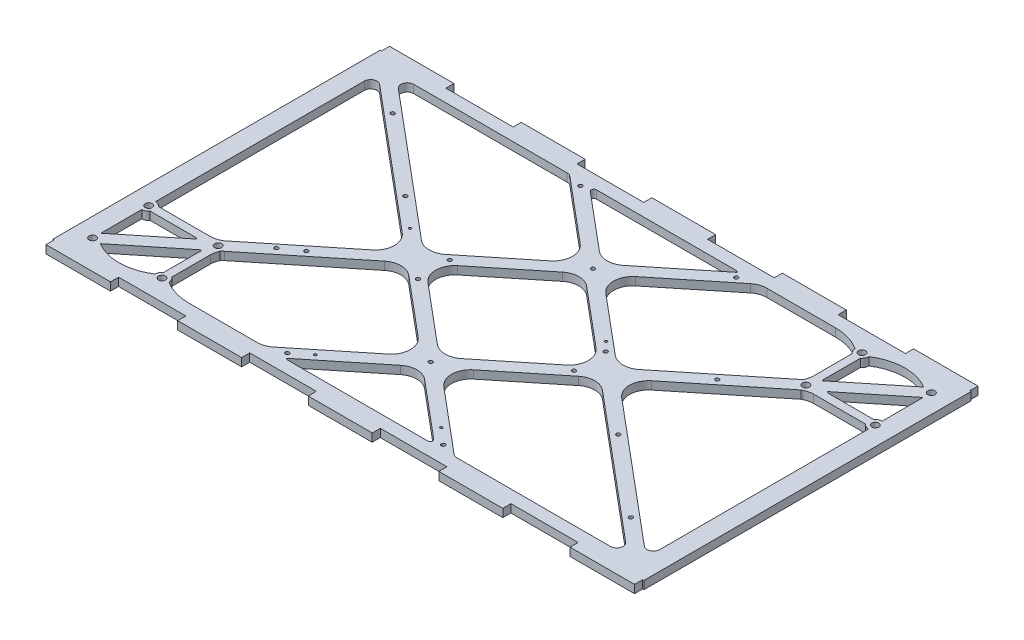
from build123d import *

# Parameters (mm, degrees)
SKETCH1_W           = 464.02
SKETCH1_H           = 269.7
BOSS_EXTRUDE1_DEPTH = 6.35
SKETCH2_R           = 2.75
CUT_EXTRUDE1_DEPTH  = 6.35
CUT_EXTRUDE2_DEPTH  = 6.35
SKETCH5_W           = 1
SKETCH5_H           = 6.36
SKETCH5_W_2         = 52.8
SKETCH5_W_3         = 52.31
CUT_EXTRUDE3_DEPTH  = 10
SKETCH7_R           = 2.75
BOSS_EXTRUDE2_DEPTH = 6.35
FILLET3_DEPTH       = 6.35
SKETCH8_R           = 1.5
CUT_EXTRUDE4_DEPTH  = 10
SKETCH9_R           = 1
SKETCH9_R_2         = 1.5
CUT_EXTRUDE5_DEPTH  = 269.427802398


with BuildPart() as part:
    # Sketch1 → Boss-Extrude1 (new body)
    with BuildSketch(Plane(origin=(0, 0, 0), x_dir=(1, 0, 0), z_dir=(0, 1, 0))):
        Rectangle(SKETCH1_W, SKETCH1_H)
    extrude(amount=BOSS_EXTRUDE1_DEPTH)

    # Sketch2 → Cut-Extrude1 (cut)
    with BuildSketch(Plane.XZ):
        with Locations(Location((-217.25, 112, 0), (0, 0, 270))):
            Circle(SKETCH2_R)
        with Locations(Location((-162.75, 112, 0), (0, 0, 270))):
            Circle(SKETCH2_R)
        with Locations(Location((-162.75, 68, 0), (0, 0, 270))):
            Circle(SKETCH2_R)
        with Locations(Location((-217.25, 68, 0), (0, 0, 270))):
            Circle(SKETCH2_R)
        with Locations(Location((217.25, -112, 0), (0, 0, 270))):
            Circle(SKETCH2_R)
        with Locations(Location((162.75, -112, 0), (0, 0, 270))):
            Circle(SKETCH2_R)
        with Locations(Location((162.75, -68, 0), (0, 0, 270))):
            Circle(SKETCH2_R)
        with Locations(Location((217.25, -68, 0), (0, 0, 270))):
            Circle(SKETCH2_R)
    extrude(amount=-CUT_EXTRUDE1_DEPTH, mode=Mode.SUBTRACT)

    # Sketch3 → Cut-Extrude2 (cut)
    with BuildSketch(Plane.XZ):
        with BuildLine():
            Line((-97.587389001, -11.684607619), (-209.038267705, -105.093705424))
            ThreePointArc((-209.038267705, -105.093705424), (-214.36439572, -105.792563893), (-217.25, -101.261633443))
            Line((-217.25, -101.261633443), (-217.25, 62.575))
            ThreePointArc((-217.25, 62.575), (-214.779549636, 63.17014493), (-212.85113651, 64.825))
            Line((-212.85113651, 64.825), (-167.14886349, 64.825))
            ThreePointArc((-167.14886349, 64.825), (-164.557122119, 62.884832882), (-161.321795409, 62.766372516))
            Line((-161.321795409, 62.766372516), (-97.80002183, 11.482738801))
            ThreePointArc((-97.80002183, 11.482738801), (-92.223217631, -0.050725582), (-97.587389001, -11.684607619))
        make_face()
        with BuildLine():
            ThreePointArc((-165.925, 78.829008315), (-167.062643852, 77.024474615), (-169.181341874, 77.272857585))
            Line((-169.181341874, 77.272857585), (-211.744216533, 111.635545383))
            ThreePointArc((-211.744216533, 111.635545383), (-211.82787845, 111.822366659), (-211.726153813, 112))
            ThreePointArc((-211.726153813, 112), (-189.950576907, 118.5), (-168.175, 112))
            ThreePointArc((-168.175, 112), (-167.57985507, 109.529549636), (-165.925, 107.60113651))
            Line((-165.925, 107.60113651), (-165.925, 78.829008315))
        make_face()
        with BuildLine():
            ThreePointArc((-69.195399046, 12.111258303), (-78.692929836, 8.60810599), (-88.253159987, 11.936343767))
            Line((-88.253159987, 11.936343767), (-157.332909959, 67.707151084))
            ThreePointArc((-157.332909959, 67.707151084), (-157.855202339, 70.339141051), (-159.575, 72.39886349))
            Line((-159.575, 72.39886349), (-159.575, 107.60113651))
            ThreePointArc((-159.575, 107.60113651), (-157.92014493, 109.529549636), (-157.325, 112))
            ThreePointArc((-157.325, 112), (-146.911924464, 116.840330407), (-135.549423093, 118.5))
            Line((-135.549423093, 118.5), (-75.076473615, 118.5))
            ThreePointArc((-75.076473615, 118.5), (-73.410923275, 118.21443974), (-71.93561893, 117.390376826))
            Line((-71.93561893, 117.390376826), (-20.746121324, 76.063076007))
            ThreePointArc((-20.746121324, 76.063076007), (-15.169317125, 64.529611624), (-20.533488495, 52.895729587))
            Line((-20.533488495, 52.895729587), (-69.195399046, 12.111258303))
        make_face()
        with BuildLine():
            ThreePointArc((-85.139517992, -14.299582162), (-75.641987202, -10.796429849), (-66.081757051, -14.124667626))
            Line((-66.081757051, -14.124667626), (-20.519005299, -50.909274546))
            ThreePointArc((-20.519005299, -50.909274546), (-14.942201099, -62.442738929), (-20.306372469, -74.076620966))
            Line((-20.306372469, -74.076620966), (-71.916527557, -117.332071981))
            ThreePointArc((-71.916527557, -117.332071981), (-73.419511758, -118.198955198), (-75.128259852, -118.5))
            Line((-75.128259852, -118.5), (-195.716337306, -118.5))
            ThreePointArc((-195.716337306, -118.5), (-200.415292504, -115.208748094), (-198.928069601, -109.667928019))
            Line((-198.928069601, -109.667928019), (-85.139517992, -14.299582162))
        make_face()
        with BuildLine():
            ThreePointArc((-56.534895208, -13.67106266), (-62.111699407, -2.137598277), (-56.747528037, 9.49628376))
            Line((-56.747528037, 9.49628376), (-8.085617485, 50.280755044))
            ThreePointArc((-8.085617485, 50.280755044), (1.411913304, 53.783907357), (10.972143455, 50.45566958))
            Line((10.972143455, 50.45566958), (56.534895208, 13.67106266))
            ThreePointArc((56.534895208, 13.67106266), (62.111699407, 2.137598277), (56.747528037, -9.49628376))
            Line((56.747528037, -9.49628376), (8.085617485, -50.280755044))
            ThreePointArc((8.085617485, -50.280755044), (-1.411913304, -53.783907357), (-10.972143455, -50.45566958))
            Line((-10.972143455, -50.45566958), (-56.534895208, -13.67106266))
        make_face()
        with BuildLine():
            ThreePointArc((-52.242235331, -118.5), (-54.12181741, -117.183499238), (-53.526928249, -114.967171208))
            Line((-53.526928249, -114.967171208), (-7.85850146, -76.691595509))
            ThreePointArc((-7.85850146, -76.691595509), (1.63902933, -73.188443196), (11.199259481, -76.516680973))
            Line((11.199259481, -76.516680973), (58.796547484, -114.94384927))
            ThreePointArc((58.796547484, -114.94384927), (59.425981506, -117.166220136), (57.54020561, -118.5))
            Line((57.54020561, -118.5), (-52.242235331, -118.5))
        make_face()
        with BuildLine():
            Line((20.533488495, -52.895729587), (69.195399046, -12.111258303))
            ThreePointArc((69.195399046, -12.111258303), (78.692929836, -8.60810599), (88.253159987, -11.936343767))
            Line((88.253159987, -11.936343767), (157.332909959, -67.707151084))
            ThreePointArc((157.332909959, -67.707151084), (157.855202339, -70.339141051), (159.575, -72.39886349))
            Line((159.575, -72.39886349), (159.575, -107.60113651))
            ThreePointArc((159.575, -107.60113651), (157.92014493, -109.529549636), (157.325, -112))
            ThreePointArc((157.325, -112), (146.911924464, -116.840330407), (135.549423093, -118.5))
            Line((135.549423093, -118.5), (73.310038543, -118.5))
            Line((73.310038543, -118.5), (20.746121324, -76.063076007))
            ThreePointArc((20.746121324, -76.063076007), (15.169317125, -64.529611624), (20.533488495, -52.895729587))
        make_face()
        with BuildLine():
            ThreePointArc((85.139517992, 14.299582162), (75.641987202, 10.796429849), (66.081757051, 14.124667626))
            Line((66.081757051, 14.124667626), (20.519005299, 50.909274546))
            ThreePointArc((20.519005299, 50.909274546), (14.942201099, 62.442738929), (20.306372469, 74.076620966))
            Line((20.306372469, 74.076620966), (71.916527557, 117.332071981))
            ThreePointArc((71.916527557, 117.332071981), (73.419511758, 118.198955198), (75.128259852, 118.5))
            Line((75.128259852, 118.5), (195.716337306, 118.5))
            ThreePointArc((195.716337306, 118.5), (200.415292504, 115.208748094), (198.928069601, 109.667928019))
            Line((198.928069601, 109.667928019), (85.139517992, 14.299582162))
        make_face()
        with BuildLine():
            Line((52.242235331, 118.5), (-57.54020561, 118.5))
            ThreePointArc((-57.54020561, 118.5), (-59.425981506, 117.166220136), (-58.796547484, 114.94384927))
            Line((-58.796547484, 114.94384927), (-11.199259481, 76.516680973))
            ThreePointArc((-11.199259481, 76.516680973), (-1.63902933, 73.188443196), (7.85850146, 76.691595509))
            Line((7.85850146, 76.691595509), (53.526928249, 114.967171208))
            ThreePointArc((53.526928249, 114.967171208), (54.12181741, 117.183499238), (52.242235331, 118.5))
        make_face()
        with BuildLine():
            ThreePointArc((97.80002183, -11.482738801), (92.223217631, 0.050725582), (97.587389001, 11.684607619))
            Line((97.587389001, 11.684607619), (209.038267705, 105.093705424))
            ThreePointArc((209.038267705, 105.093705424), (214.36439572, 105.792563893), (217.25, 101.261633443))
            Line((217.25, 101.261633443), (217.25, -62.575))
            ThreePointArc((217.25, -62.575), (214.779549636, -63.17014493), (212.85113651, -64.825))
            Line((212.85113651, -64.825), (167.14886349, -64.825))
            ThreePointArc((167.14886349, -64.825), (164.557122119, -62.884832882), (161.321795409, -62.766372516))
            Line((161.321795409, -62.766372516), (97.80002183, -11.482738801))
        make_face()
        with BuildLine():
            Line((212.85113651, -71.175), (177.398146663, -71.175))
            ThreePointArc((177.398146663, -71.175), (175.512370767, -72.508779864), (176.141804789, -74.73115073))
            Line((176.141804789, -74.73115073), (215.394975362, -106.421783854))
            ThreePointArc((215.394975362, -106.421783854), (216.60192389, -106.563278987), (217.25, -105.53529894))
            Line((217.25, -105.53529894), (217.25, -73.425))
            ThreePointArc((217.25, -73.425), (214.779549636, -72.82985507), (212.85113651, -71.175))
        make_face()
        with BuildLine():
            ThreePointArc((165.925, -78.829008315), (167.062643852, -77.024474615), (169.181341874, -77.272857585))
            Line((169.181341874, -77.272857585), (211.744216533, -111.635545383))
            ThreePointArc((211.744216533, -111.635545383), (211.82787845, -111.822366659), (211.726153813, -112))
            ThreePointArc((211.726153813, -112), (189.950576907, -118.5), (168.175, -112))
            ThreePointArc((168.175, -112), (167.57985507, -109.529549636), (165.925, -107.60113651))
            Line((165.925, -107.60113651), (165.925, -78.829008315))
        make_face()
        with BuildLine():
            Line((-176.141804789, 74.73115073), (-215.394975362, 106.421783854))
            ThreePointArc((-215.394975362, 106.421783854), (-216.60192389, 106.563278987), (-217.25, 105.53529894))
            Line((-217.25, 105.53529894), (-217.25, 73.425))
            ThreePointArc((-217.25, 73.425), (-214.779549636, 72.82985507), (-212.85113651, 71.175))
            Line((-212.85113651, 71.175), (-177.398146663, 71.175))
            ThreePointArc((-177.398146663, 71.175), (-175.512370767, 72.508779864), (-176.141804789, 74.73115073))
        make_face()
    extrude(amount=-CUT_EXTRUDE2_DEPTH, mode=Mode.SUBTRACT)

    # Sketch5 → Cut-Extrude3 (cut)
    with BuildSketch(Plane.XZ):
        with Locations((-231.51, -131.67)):
            Rectangle(SKETCH5_W, SKETCH5_H)
        with Locations((-154.01, -131.67)):
            Rectangle(SKETCH5_W_2, SKETCH5_H)
        with Locations((-51.255, -131.67)):
            Rectangle(SKETCH5_W_3, SKETCH5_H)
        with Locations((51.255, -131.67)):
            Rectangle(SKETCH5_W_3, SKETCH5_H)
        with Locations((154.01, -131.67)):
            Rectangle(SKETCH5_W_2, SKETCH5_H)
        with Locations((231.51, -131.67)):
            Rectangle(SKETCH5_W, SKETCH5_H)
    cut_extrude3 = extrude(amount=-CUT_EXTRUDE3_DEPTH, mode=Mode.SUBTRACT)

    # Mirror1: Cut-Extrude3 across plane
    add(cut_extrude3.mirror(Plane.XY), mode=Mode.SUBTRACT)

    # Sketch7 → Boss-Extrude2 (add)
    # profile 1 of 2: a face of its own
    with BuildSketch(Plane.XZ):
        with BuildLine():
            Line((-175.738034604, 72.05963999), (-77.108038552, -7.568246732))
            Line((-77.108038552, -7.568246732), (0.17297798, -69.960260079))
            Line((0.17297798, -69.960260079), (60.296064928, -118.5))
            Line((60.296064928, -118.5), (76.215298708, -118.5))
            Line((76.215298708, -118.5), (7.98370424, -63.413942081))
            Line((7.98370424, -63.413942081), (-69.297312292, -1.021928734))
            Line((-69.297312292, -1.021928734), (-166.484747769, 77.441321927))
            Line((-166.484747769, 77.441321927), (-210.354813882, 112.859356954))
            ThreePointArc((-210.354813882, 112.859356954), (-215.017261044, 110.366396329), (-217.25, 105.573887282))
            Line((-217.25, 105.573887282), (-175.738034604, 72.05963999))
        make_face()
        with Locations(Location((-162.75, 68, 0), (0, 0, 270))):
            Circle(SKETCH7_R, mode=Mode.SUBTRACT)
    # profile 2 of 2: a face of its own
    with BuildSketch(Plane.XZ):
        with BuildLine():
            Line((175.738034604, -72.05963999), (77.108038552, 7.568246732))
            Line((77.108038552, 7.568246732), (-0.17297798, 69.960260079))
            Line((-0.17297798, 69.960260079), (-60.296064928, 118.5))
            Line((-60.296064928, 118.5), (-76.215298708, 118.5))
            Line((-76.215298708, 118.5), (-7.98370424, 63.413942081))
            Line((-7.98370424, 63.413942081), (69.297312292, 1.021928734))
            Line((69.297312292, 1.021928734), (166.484747769, -77.441321927))
            Line((166.484747769, -77.441321927), (210.354813882, -112.859356954))
            ThreePointArc((210.354813882, -112.859356954), (215.017261044, -110.366396329), (217.25, -105.573887282))
            Line((217.25, -105.573887282), (175.738034604, -72.05963999))
        make_face()
        with Locations(Location((162.75, -68, 0), (0, 0, 270))):
            Circle(SKETCH7_R, mode=Mode.SUBTRACT)
    extrude(amount=-BOSS_EXTRUDE2_DEPTH)

    # Fillet3: read off the stored shape, not the designer's step
    # Fillet3 outline → Fillet3 (add)
    with BuildSketch(Plane(origin=(0, 0, 0), x_dir=(1, 0, 0), z_dir=(0, 1, 0))):
        with BuildLine():
            Line((-76.215298708, -118.5), (-72.092039868, -115.171130478))
            ThreePointArc((-72.092039868, -115.171130478), (-76.517952903, -117.643319221), (-81.514603923, -118.5))
            Line((-81.514603923, -118.5), (-76.215298708, -118.5))
        make_face()
        with BuildLine():
            ThreePointArc((-158.178272267, -70.998655692), (-157.316608127, -70.105503813), (-156.384060469, -69.286638602))
            Line((-156.384060469, -69.286638602), (-157.971370599, -70.568136688))
            ThreePointArc((-157.971370599, -70.568136688), (-158.669197957, -71.574588044), (-159.575, -72.39886349))
            Line((-159.575, -72.39886349), (-159.575, -77.31933474))
            ThreePointArc((-159.575, -77.31933474), (-159.221656342, -74.08275352), (-158.178272267, -70.998655692))
        make_face()
        with BuildLine():
            ThreePointArc((-86.827702444, -13.131046802), (-77.267472294, -9.802809025), (-67.769941504, -13.305961337))
            Line((-67.769941504, -13.305961337), (-69.195399046, -12.111258303))
            ThreePointArc((-69.195399046, -12.111258303), (-74.997676546, -9.105449249), (-81.527379323, -8.851886851))
            Line((-81.527379323, -8.851886851), (-86.827702444, -13.131046802))
        make_face()
        with BuildLine():
            ThreePointArc((-21.958946037, -51.701026552), (-16.594774667, -63.334908589), (-22.171578867, -74.868372972))
            Line((-22.171578867, -74.868372972), (-16.313164581, -70.138644008))
            ThreePointArc((-16.313164581, -70.138644008), (-15.598751311, -60.825852254), (-20.533488495, -52.895729587))
            Line((-20.533488495, -52.895729587), (-21.958946037, -51.701026552))
        make_face()
        with BuildLine():
            ThreePointArc((-9.773801938, -77.711384008), (-0.213571788, -74.383146231), (9.283959002, -77.886298543))
            Line((9.283959002, -77.886298543), (7.85850146, -76.691595509))
            ThreePointArc((7.85850146, -76.691595509), (2.05622396, -73.685786455), (-4.473478817, -73.432224057))
            Line((-4.473478817, -73.432224057), (-9.773801938, -77.711384008))
        make_face()
        with BuildLine():
            ThreePointArc((9.546685912, -49.260966545), (-0.013544238, -52.589204322), (-9.511075028, -49.086052009))
            Line((-9.511075028, -49.086052009), (-8.085617485, -50.280755044))
            ThreePointArc((-8.085617485, -50.280755044), (-2.283339986, -53.286564098), (4.246362791, -53.540126496))
            Line((4.246362791, -53.540126496), (9.546685912, -49.260966545))
        make_face()
        with BuildLine():
            Line((-56.747528037, -9.49628376), (-55.322070495, -10.690986794))
            ThreePointArc((-55.322070495, -10.690986794), (-60.686241865, 0.942895243), (-55.109437665, 12.476359625))
            Line((-55.109437665, 12.476359625), (-60.967851951, 7.746630661))
            ThreePointArc((-60.967851951, 7.746630661), (-61.682265221, -1.566161093), (-56.747528037, -9.49628376))
        make_face()
        with BuildLine():
            ThreePointArc((55.322070495, 10.690986794), (60.686241865, -0.942895243), (55.109437665, -12.476359625))
            Line((55.109437665, -12.476359625), (60.967851951, -7.746630661))
            ThreePointArc((60.967851951, -7.746630661), (61.682265221, 1.566161093), (56.747528037, 9.49628376))
            Line((56.747528037, 9.49628376), (55.322070495, 10.690986794))
        make_face()
        with BuildLine():
            Line((-4.246362791, 53.540126496), (-9.546685912, 49.260966545))
            ThreePointArc((-9.546685912, 49.260966545), (0.013544238, 52.589204322), (9.511075028, 49.086052009))
            Line((9.511075028, 49.086052009), (8.085617485, 50.280755044))
            ThreePointArc((8.085617485, 50.280755044), (2.283339986, 53.286564098), (-4.246362791, 53.540126496))
        make_face()
        with BuildLine():
            Line((20.306372469, -74.076620966), (21.731830011, -75.271324))
            ThreePointArc((21.731830011, -75.271324), (16.367658641, -63.637441963), (21.944462841, -52.103977581))
            Line((21.944462841, -52.103977581), (16.086048555, -56.833706545))
            ThreePointArc((16.086048555, -56.833706545), (15.371635286, -66.146498299), (20.306372469, -74.076620966))
        make_face()
        with BuildLine():
            Line((72.807537715, -11.04021071), (67.507214594, -15.319370661))
            ThreePointArc((67.507214594, -15.319370661), (77.067444744, -11.991132884), (86.564975534, -15.494285197))
            Line((86.564975534, -15.494285197), (85.139517992, -14.299582162))
            ThreePointArc((85.139517992, -14.299582162), (79.337240492, -11.293773108), (72.807537715, -11.04021071))
        make_face()
        with BuildLine():
            ThreePointArc((167.14886349, 64.825), (166.284971504, 63.884832753), (165.22527006, 63.172613219))
            ThreePointArc((165.22527006, 63.172613219), (168.548979523, 64.406052745), (172.06933474, 64.825))
            Line((172.06933474, 64.825), (167.14886349, 64.825))
        make_face()
        with BuildLine():
            ThreePointArc((99.012846543, -12.879310654), (93.648675173, -1.245428617), (99.225479373, 10.288035766))
            Line((99.225479373, 10.288035766), (93.367065087, 5.558306801))
            ThreePointArc((93.367065087, 5.558306801), (92.652651818, -3.754484953), (97.587389001, -11.684607619))
            Line((97.587389001, -11.684607619), (99.012846543, -12.879310654))
        make_face()
        with BuildLine():
            ThreePointArc((159.575, 77.31933474), (159.221656342, 74.08275352), (158.178272267, 70.998655692))
            ThreePointArc((158.178272267, 70.998655692), (157.316608127, 70.105503813), (156.384060469, 69.286638602))
            Line((156.384060469, 69.286638602), (157.971370599, 70.568136688))
            ThreePointArc((157.971370599, 70.568136688), (158.669197957, 71.574588044), (159.575, 72.39886349))
            Line((159.575, 72.39886349), (159.575, 77.31933474))
        make_face()
        with BuildLine():
            Line((76.215298708, 118.5), (72.092039868, 115.171130478))
            ThreePointArc((72.092039868, 115.171130478), (76.517952903, 117.643319221), (81.514603923, 118.5))
            Line((81.514603923, 118.5), (76.215298708, 118.5))
        make_face()
        with BuildLine():
            Line((20.533488495, 52.895729587), (21.958946037, 51.701026552))
            ThreePointArc((21.958946037, 51.701026552), (16.594774667, 63.334908589), (22.171578867, 74.868372972))
            Line((22.171578867, 74.868372972), (16.313164581, 70.138644008))
            ThreePointArc((16.313164581, 70.138644008), (15.598751311, 60.825852254), (20.533488495, 52.895729587))
        make_face()
        with BuildLine():
            Line((81.527379323, 8.851886851), (86.827702444, 13.131046802))
            ThreePointArc((86.827702444, 13.131046802), (77.267472294, 9.802809025), (67.769941504, 13.305961337))
            Line((67.769941504, 13.305961337), (69.195399046, 12.111258303))
            ThreePointArc((69.195399046, 12.111258303), (74.997676546, 9.105449249), (81.527379323, 8.851886851))
        make_face()
        with BuildLine():
            ThreePointArc((-167.14886349, -64.825), (-166.284971504, -63.884832753), (-165.22527006, -63.172613219))
            ThreePointArc((-165.22527006, -63.172613219), (-168.548979523, -64.406052745), (-172.06933474, -64.825))
            Line((-172.06933474, -64.825), (-167.14886349, -64.825))
        make_face()
        with BuildLine():
            ThreePointArc((-99.012846543, 12.879310654), (-93.648675173, 1.245428617), (-99.225479373, -10.288035766))
            Line((-99.225479373, -10.288035766), (-93.367065087, -5.558306801))
            ThreePointArc((-93.367065087, -5.558306801), (-92.652651818, 3.754484953), (-97.587389001, 11.684607619))
            Line((-97.587389001, 11.684607619), (-99.012846543, 12.879310654))
        make_face()
        with BuildLine():
            Line((-72.807537715, 11.04021071), (-67.507214594, 15.319370661))
            ThreePointArc((-67.507214594, 15.319370661), (-77.067444744, 11.991132884), (-86.564975534, 15.494285197))
            Line((-86.564975534, 15.494285197), (-85.139517992, 14.299582162))
            ThreePointArc((-85.139517992, 14.299582162), (-79.337240492, 11.293773108), (-72.807537715, 11.04021071))
        make_face()
        with BuildLine():
            ThreePointArc((-21.731830011, 75.271324), (-16.367658641, 63.637441963), (-21.944462841, 52.103977581))
            Line((-21.944462841, 52.103977581), (-16.086048555, 56.833706545))
            ThreePointArc((-16.086048555, 56.833706545), (-15.371635286, 66.146498299), (-20.306372469, 74.076620966))
            Line((-20.306372469, 74.076620966), (-21.731830011, 75.271324))
        make_face()
        with BuildLine():
            ThreePointArc((9.773801938, 77.711384008), (0.213571788, 74.383146231), (-9.283959002, 77.886298543))
            Line((-9.283959002, 77.886298543), (-7.85850146, 76.691595509))
            ThreePointArc((-7.85850146, 76.691595509), (-2.05622396, 73.685786455), (4.473478817, 73.432224057))
            Line((4.473478817, 73.432224057), (9.773801938, 77.711384008))
        make_face()
    extrude(amount=FILLET3_DEPTH)

    # Sketch8 → Cut-Extrude4 (cut)
    with BuildSketch(Plane.XZ):
        with Locations(Location((124.219909091, -36.893137614, 0), (0, 0, 270))):
            Circle(SKETCH8_R)
        with Locations(Location((61.426709704, -12.098458556, 0), (0, 0, 270))):
            Circle(SKETCH8_R)
        with Locations(Location((0.113558013, -63.486175276, 0), (0, 0, 270))):
            Circle(SKETCH8_R)
        with Locations(Location((62.359587227, -113.739850238, 0), (0, 0, 270))):
            Circle(SKETCH8_R)
        with Locations(Location((-61.199593678, -114.873891996, 0), (0, 0, 270))):
            Circle(SKETCH8_R)
        with Locations(Location((61.973879877, 13.360537347, 0), (0, 0, 270))):
            Circle(SKETCH8_R)
        with Locations(Location((122.739861395, 39.289258164, 0), (0, 0, 270))):
            Circle(SKETCH8_R)
        with Locations(Location((184.053013086, 90.676974884, 0), (0, 0, 270))):
            Circle(SKETCH8_R)
        with Locations(Location((61.041002354, 115.001929029, 0), (0, 0, 270))):
            Circle(SKETCH8_R)
        with Locations(Location((-0.272149337, 63.614212309, 0), (0, 0, 270))):
            Circle(SKETCH8_R)
        with Locations(Location((-62.51817855, 113.86788727, 0), (0, 0, 270))):
            Circle(SKETCH8_R)
        with Locations(Location((-124.378500414, 37.021174647, 0), (0, 0, 270))):
            Circle(SKETCH8_R)
        with Locations(Location((-61.585301028, 12.226495589, 0), (0, 0, 270))):
            Circle(SKETCH8_R)
        with Locations(Location((-62.132471201, -13.232500315, 0), (0, 0, 270))):
            Circle(SKETCH8_R)
        with Locations(Location((-122.898452719, -39.161221131, 0), (0, 0, 270))):
            Circle(SKETCH8_R)
        with Locations(Location((-184.21160441, -90.548937851, 0), (0, 0, 270))):
            Circle(SKETCH8_R)
    extrude(amount=-CUT_EXTRUDE4_DEPTH, mode=Mode.SUBTRACT)

    # Sketch9 → Cut-Extrude5 (cut, through all)
    with BuildSketch(Plane(origin=(0, 6.35, 0), x_dir=(1, 0, 0), z_dir=(0, 1, 0))):
        with Locations(Location((-50.403, -104.012, 0), (0, 0, 270))):
            Circle(SKETCH9_R)
        with Locations(Location((48.597, -104.012, 0), (0, 0, 270))):
            Circle(SKETCH9_R)
        with Locations(Location((54.637, 19.178, 0), (0, 0, 270))):
            Circle(SKETCH9_R)
        with Locations(Location((-99.173, 19.178, 0), (0, 0, 270))):
            Circle(SKETCH9_R)
        with Locations(Location((-138.173, -46.814423808, 0), (0, 0, 270))):
            Circle(SKETCH9_R_2)
    extrude(amount=-CUT_EXTRUDE5_DEPTH, mode=Mode.SUBTRACT)


solid = part.part
